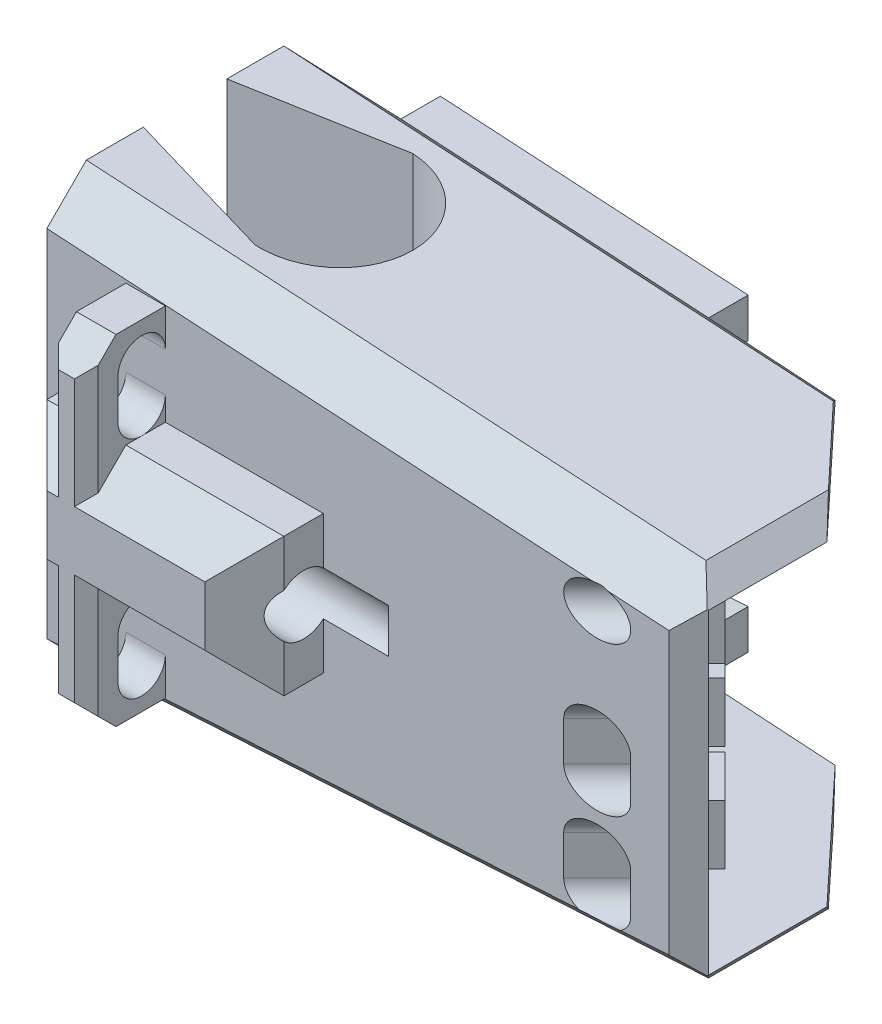
from build123d import *

# Parameters (mm, degrees)
BOSS_EXTRUDE1_DEPTH      = 7
CHAMFER1_SIZE            = 1
CHAMFER7_SIZE            = 1
CHAMFER7_EDGE_2_SIZE     = 1
CHAMFER7_EDGE_2_SIZE2    = 1.065385663
CHAMFER7_EDGE_3_SIZE     = 1
CHAMFER7_EDGE_4_SIZE     = 1
CHAMFER7_EDGE_4_SIZE2    = 1.065385663
CHAMFER14_SIZE           = 1
CHAMFER14_SIZE2          = 1.962610506
SKETCH13_W               = 6
SKETCH13_H               = 3.5
BOSS_EXTRUDE4_DEPTH      = 2
CUT_EXTRUDE9_DEPTH       = 2
CUT_EXTRUDE9_DEPTH_BACK  = 7.647280269
SKETCH14_R               = 0.75
CHAMFER15_SIZE           = 1
SKETCH15_W               = 4
SKETCH15_H               = 3.5
BOSS_EXTRUDE6_DEPTH      = 2
CUT_EXTRUDE10_DEPTH      = 2
CUT_EXTRUDE10_DEPTH_BACK = 6
SKETCH18_R               = 0.75
CHAMFER16_SIZE           = 1
CUT_EXTRUDE12_REACH      = 23.967
SKETCH19_W               = 7.661214419
SKETCH19_H               = 8
CUT_EXTRUDE14_DEPTH      = 10
CUT_EXTRUDE14_DEPTH_BACK = 2
SKETCH23_W               = 1.5
SKETCH23_H               = 1.5
BOSS_EXTRUDE7_DEPTH      = 0.3
SKETCH30_W               = 1
SKETCH30_H               = 3.55
BOSS_EXTRUDE12_DEPTH     = 2
CHAMFER19_SIZE           = 0.3
CHAMFER20_SIZE           = 0.75
CUT_EXTRUDE32_DEPTH      = 1.23
CUT_EXTRUDE33_REACH      = 23.588
CUT_EXTRUDE34_REACH      = 23.045
SKETCH38_R               = 0.6
BOSS_EXTRUDE13_DEPTH     = 1
CUT_EXTRUDE35_DEPTH      = 1


with BuildPart() as part:
    # Sketch2 → Boss-Extrude1 (new body)
    with BuildSketch(Plane.XY):
        Polygon((0, 0), (0, 11), (16.75, 10), (16.75, 1), align=None)
    extrude(amount=BOSS_EXTRUDE1_DEPTH)

    # Chamfer1
    chamfer1_edges = [part.edges().sort_by_distance(p)[0] for p in [
        (8.375, 10.5, 7),
        (8.375, 0.5, 7),
        (8.375, 10.5, 0),
        (8.375, 0.5, 0),
    ]]
    chamfer(chamfer1_edges, length=CHAMFER1_SIZE)

    # Chamfer7
    chamfer7_edges = [part.edges().sort_by_distance(p)[0] for p in [
        (16.75, 5.5, 7),
    ]]
    chamfer(chamfer7_edges, length=CHAMFER7_SIZE)

    # Chamfer7 edge 2
    chamfer7_edge_2_edges = [part.edges().sort_by_distance(p)[0] for p in [
        (16.75, 1, 3.5),
    ]]
    chamfer7_edge_2_side = [part.faces().sort_by_distance(p)[0] for p in [
        (8.375, 0.5, 3.5),
    ]]
    chamfer(chamfer7_edge_2_edges, length=CHAMFER7_EDGE_2_SIZE, length2=CHAMFER7_EDGE_2_SIZE2, reference=chamfer7_edge_2_side[0])

    # Chamfer7 edge 3
    chamfer7_edge_3_edges = [part.edges().sort_by_distance(p)[0] for p in [
        (16.75, 5.5, 0),
    ]]
    chamfer(chamfer7_edge_3_edges, length=CHAMFER7_EDGE_3_SIZE)

    # Chamfer7 edge 4
    chamfer7_edge_4_edges = [part.edges().sort_by_distance(p)[0] for p in [
        (16.75, 10, 3.5),
    ]]
    chamfer7_edge_4_side = [part.faces().sort_by_distance(p)[0] for p in [
        (16.75, 5.5, 3.5),
    ]]
    chamfer(chamfer7_edge_4_edges, length=CHAMFER7_EDGE_4_SIZE, length2=CHAMFER7_EDGE_4_SIZE2, reference=chamfer7_edge_4_side[0])

    # Chamfer14
    chamfer14_edges = [part.edges().sort_by_distance(p)[0] for p in [
        (0, 5.5, 0),
    ]]
    chamfer14_side = [part.faces().sort_by_distance(p)[0] for p in [
        (0, 5.5, 3.5),
    ]]
    chamfer(chamfer14_edges, length=CHAMFER14_SIZE, length2=CHAMFER14_SIZE2, reference=chamfer14_side[0])

    # Sketch13 → Boss-Extrude4 (add)
    with BuildSketch(Plane.XY.offset(7)):
        with Locations((4, 5.5)):
            Rectangle(SKETCH13_W, SKETCH13_H)
    extrude(amount=BOSS_EXTRUDE4_DEPTH)

    # Sketch14 → Cut-Extrude9 (cut, two sides: drawn at the far end of the back side and taken through both)
    with BuildSketch(Plane.ZY.offset(-1).offset(-CUT_EXTRUDE9_DEPTH_BACK)):
        with Locations(Location((7.5, 5.5, 0), (0, 0, 131.810314896))):
            Circle(SKETCH14_R)
    extrude(amount=CUT_EXTRUDE9_DEPTH + CUT_EXTRUDE9_DEPTH_BACK, mode=Mode.SUBTRACT)

    # Chamfer15
    # the kernel refuses this chamfer: 1 mm, written as the material it takes off along each edge
    with BuildSketch(Plane(origin=(7, 1.178317012, 9), x_dir=(0.027495876610586487, 0, -0.9996219169112968), z_dir=(0, 1, 0)), Plane(origin=(1, 9.821682988, 9), x_dir=(-0.02749587661058638, 0, -0.9996219169112968), z_dir=(0, -1, 0))) as chamfer15_piece_1:
        Polygon((CHAMFER15_SIZE * 0.999621916911, CHAMFER15_SIZE * 0.0274958766106), (-CHAMFER15_SIZE * 0.0274958766106, CHAMFER15_SIZE * 0.999621916911), (0, 0), align=None)
    extrude(amount=8.643365976, mode=Mode.SUBTRACT)
    with BuildSketch(Plane(origin=(9.571682988, 7.25, 9), x_dir=(0, 0.027495876610586487, -0.9996219169112968), z_dir=(-1, 0, 0)), Plane(origin=(-1.571682988, 3.75, 9), x_dir=(0, -0.027495876610586487, -0.9996219169112968), z_dir=(1, 0, 0))) as chamfer15_piece_2:
        Polygon((CHAMFER15_SIZE * 0.999621916911, CHAMFER15_SIZE * 0.0274958766106), (-CHAMFER15_SIZE * 0.0274958766106, CHAMFER15_SIZE * 0.999621916911), (0, 0), align=None)
    extrude(amount=11.143365976, mode=Mode.SUBTRACT)

    # Sketch15 → Boss-Extrude6 (add)
    with BuildSketch(Plane(origin=(0, 0, 0), x_dir=(-1, 0, 0), z_dir=(0, 0, -1))):
        with Locations((-4.962610506, 5.5)):
            Rectangle(SKETCH15_W, SKETCH15_H)
    extrude(amount=BOSS_EXTRUDE6_DEPTH)

    # Sketch18 → Cut-Extrude10 (cut, two sides: drawn at the far end of the back side and taken through both)
    with BuildSketch(Plane.ZY.offset(-2.962610506).offset(-CUT_EXTRUDE10_DEPTH_BACK)):
        with Locations(Location((-0.5, 5.5, 0), (0, 0, 48.189685104))):
            Circle(SKETCH18_R)
    extrude(amount=CUT_EXTRUDE10_DEPTH + CUT_EXTRUDE10_DEPTH_BACK, mode=Mode.SUBTRACT)

    # Chamfer16
    # the kernel refuses this chamfer: 1 mm, written as the material it takes off along each edge
    with BuildSketch(Plane(origin=(6.962610506, 1.178317012, -2), x_dir=(0.027495876610586487, 0, 0.9996219169112968), z_dir=(0, 1, 0)), Plane(origin=(2.962610506, 9.821682988, -2), x_dir=(-0.027495876610586487, 0, 0.9996219169112968), z_dir=(0, -1, 0))) as chamfer16_piece_1:
        Polygon((CHAMFER16_SIZE * 0.999621916911, -CHAMFER16_SIZE * 0.0274958766106), (-CHAMFER16_SIZE * 0.0274958766106, -CHAMFER16_SIZE * 0.999621916911), (0, 0), align=None)
    extrude(amount=8.643365976, mode=Mode.SUBTRACT)
    with BuildSketch(Plane(origin=(0.390927518, 3.75, -2), x_dir=(0, -0.027495876610586487, 0.9996219169112968), z_dir=(1, 0, 0)), Plane(origin=(9.534293493, 7.25, -2), x_dir=(0, 0.027495876610586487, 0.9996219169112968), z_dir=(-1, 0, 0))) as chamfer16_piece_2:
        Polygon((CHAMFER16_SIZE * 0.999621916911, -CHAMFER16_SIZE * 0.0274958766106), (-CHAMFER16_SIZE * 0.0274958766106, -CHAMFER16_SIZE * 0.999621916911), (0, 0), align=None)
    extrude(amount=9.143365976, mode=Mode.SUBTRACT)

    # Cut-Extrude12: up to this plane
    cut_extrude12_end = Plane(origin=(4.875, 0, -4.875), z_dir=(0.7071067811865475, 0, -0.7071067811865477))
    # Sketch19 → Cut-Extrude12 (cut, up to the surface)
    with BuildSketch(Plane(origin=(0, 0, 0), x_dir=(-1, 0, 0), z_dir=(0, 0, -1)), mode=Mode.PRIVATE) as cut_extrude12_sk1:
        with Locations((-13.585935075, 5.5)):
            Rectangle(SKETCH19_W, SKETCH19_H)
    cut_extrude12_tool1 = split(extrude(cut_extrude12_sk1.sketch, amount=-CUT_EXTRUDE12_REACH, mode=Mode.PRIVATE), bisect_by=cut_extrude12_end, keep=Keep.BOTH, mode=Mode.PRIVATE)
    add(cut_extrude12_tool1.solids().sort_by_distance((13.585935, 5.5, 0))[0], mode=Mode.SUBTRACT)

    # Sketch21 → Cut-Extrude14 (cut, two sides: drawn at the far end of the back side and taken through both)
    with BuildSketch(Plane.XZ.offset(-9.5).offset(-CUT_EXTRUDE14_DEPTH_BACK)):
        Polygon((16.25, 3.5), (16.25, 0.5), (16.25, -4.059078881), (11.307076373, -4.059078881), (13.25, 0.292304862), align=None)
    extrude(amount=CUT_EXTRUDE14_DEPTH + CUT_EXTRUDE14_DEPTH_BACK, mode=Mode.SUBTRACT)

    # Sketch23 → Boss-Extrude7 (add)
    with BuildSketch(Plane(origin=(4.875, 0, -4.875), x_dir=(-0.7071067811865476, 0, -0.7071067811865476), z_dir=(0.7071067811865476, 0, -0.7071067811865476))):
        Polygon((-10.402444277, 2.500721643), (-10.402135029, 4.000721611), (-8.902135061, 4.000412363), (-8.902444309, 2.500412395), align=None)
        with Locations((-9.651825855, 7.75)):
            Rectangle(SKETCH23_W, SKETCH23_H)
        Polygon((-12.702349723, 2.500380076), (-12.703104511, 4.000379886), (-14.203104321, 3.999625098), (-14.202349533, 2.499625288), align=None)
        Polygon((-14.204750024, 8.499212445), (-12.70475009, 8.499657985), (-12.70430455, 6.999658051), (-14.204304484, 6.999212511), align=None)
    extrude(amount=BOSS_EXTRUDE7_DEPTH)

    # Sketch30 → Boss-Extrude12 (add)
    with BuildSketch(Plane.XY.offset(7)):
        with Locations((2.5, 8.025)):
            Rectangle(SKETCH30_W, SKETCH30_H)
        with Locations((2.5, 2.975)):
            Rectangle(SKETCH30_W, SKETCH30_H)
    extrude(amount=BOSS_EXTRUDE12_DEPTH)

    # Chamfer19
    # the kernel refuses this chamfer: 0.3 mm, written as the material it takes off along each edge
    with BuildSketch(Plane(origin=(2, 6.25, 9), x_dir=(-0.027495876610586622, 0, -0.9996219169112968), z_dir=(0, 1, 0))) as chamfer19_piece_1_section:
        Polygon((CHAMFER19_SIZE * 0.999621916911, -CHAMFER19_SIZE * 0.0274958766106), (-CHAMFER19_SIZE * 0.0274958766106, -CHAMFER19_SIZE * 0.999621916911), (0, 0), align=None)
    chamfer19_piece_1 = extrude(amount=4.321504896, mode=Mode.PRIVATE)
    chamfer19_piece_1 = split(chamfer19_piece_1, bisect_by=Plane(origin=(2.100724638, 7.211413043, 8.038586957), z_dir=(0, 0.7071067811862649, 0.7071067811868302)), keep=Keep.TOP, mode=Mode.PRIVATE)
    add(chamfer19_piece_1, mode=Mode.SUBTRACT)
    with BuildSketch(Plane(origin=(3, 10.571504896, 9), x_dir=(0.027495876610585904, 0, -0.9996219169112968), z_dir=(0, -1, 0))) as chamfer19_piece_2_section:
        Polygon((CHAMFER19_SIZE * 0.999621916911, -CHAMFER19_SIZE * 0.0274958766106), (-CHAMFER19_SIZE * 0.0274958766106, -CHAMFER19_SIZE * 0.999621916911), (0, 0), align=None)
    chamfer19_piece_2 = extrude(amount=5.093009793, mode=Mode.PRIVATE)
    chamfer19_piece_2 = split(chamfer19_piece_2, bisect_by=Plane(origin=(2.899275362, 7.211413043, 8.038586957), z_dir=(0, 0.7071067811862649, 0.7071067811868302)), keep=Keep.TOP, mode=Mode.PRIVATE)
    add(chamfer19_piece_2, mode=Mode.SUBTRACT)
    with BuildSketch(Plane(origin=(2, 0.428495104, 9), x_dir=(-0.027495876610586622, 0, -0.9996219169112968), z_dir=(0, 1, 0))) as chamfer19_piece_3_section:
        Polygon((CHAMFER19_SIZE * 0.999621916911, -CHAMFER19_SIZE * 0.0274958766106), (-CHAMFER19_SIZE * 0.0274958766106, -CHAMFER19_SIZE * 0.999621916911), (0, 0), align=None)
    chamfer19_piece_3 = extrude(amount=4.321504896, mode=Mode.PRIVATE)
    chamfer19_piece_3 = split(chamfer19_piece_3, bisect_by=Plane(origin=(2.100724638, 3.788586957, 8.038586957), z_dir=(0, -0.7071067811862649, 0.7071067811868302)), keep=Keep.TOP, mode=Mode.PRIVATE)
    add(chamfer19_piece_3, mode=Mode.SUBTRACT)
    with BuildSketch(Plane(origin=(3, 5.521504896, 9), x_dir=(0.027495876610585904, 0, -0.9996219169112968), z_dir=(0, -1, 0))) as chamfer19_piece_4_section:
        Polygon((CHAMFER19_SIZE * 0.999621916911, -CHAMFER19_SIZE * 0.0274958766106), (-CHAMFER19_SIZE * 0.0274958766106, -CHAMFER19_SIZE * 0.999621916911), (0, 0), align=None)
    chamfer19_piece_4 = extrude(amount=5.093009793, mode=Mode.PRIVATE)
    chamfer19_piece_4 = split(chamfer19_piece_4, bisect_by=Plane(origin=(2.899275362, 3.788586957, 8.038586957), z_dir=(0, -0.7071067811862649, 0.7071067811868302)), keep=Keep.TOP, mode=Mode.PRIVATE)
    add(chamfer19_piece_4, mode=Mode.SUBTRACT)

    # Chamfer20
    chamfer20_edges = [part.edges().sort_by_distance(p)[0] for p in [
        (2.5, 1.2, 9),
        (2.5, 9.8, 9),
    ]]
    chamfer(chamfer20_edges, length=CHAMFER20_SIZE)

    # Sketch35 → Cut-Extrude32 (cut)
    with BuildSketch(Plane.ZY.offset(-2)):
        with BuildLine():
            Line((8.2, 8.85), (8.2, 7.85))
            ThreePointArc((8.2, 7.85), (7.6, 7.25), (7, 7.85))
            Line((7, 7.85), (7, 8.85))
            ThreePointArc((7, 8.85), (7.6, 9.45), (8.2, 8.85))
        make_face()
        with BuildLine():
            Line((8.2, 3.15), (8.2, 2.15))
            ThreePointArc((8.2, 2.15), (7.6, 1.55), (7, 2.15))
            Line((7, 2.15), (7, 3.15))
            ThreePointArc((7, 3.15), (7.6, 3.75), (8.2, 3.15))
        make_face()
    extrude(amount=-CUT_EXTRUDE32_DEPTH, mode=Mode.SUBTRACT)

    # Cut-Extrude33: up to this plane
    cut_extrude33_end = Plane(origin=(0, 11, 7), z_dir=(-0.059595380047235344, -0.9982226157912, 0))
    # Sketch36 → Cut-Extrude33 (cut, up to the surface)
    with BuildSketch(Plane(origin=(0, 0, 0), x_dir=(0, 0, -1), z_dir=(0, 1, 0)), mode=Mode.PRIVATE) as cut_extrude33_sk1:
        with BuildLine():
            Line((-1.735294118, -2.828823529), (-3, 2.23))
            Line((-3, 2.23), (-4, 2.23))
            Line((-4, 2.23), (-5.264705882, -2.828823529))
            ThreePointArc((-5.264705882, -2.828823529), (-3.5, -1.77), (-1.735294118, -2.828823529))
        make_face()
    cut_extrude33_tool1 = split(extrude(cut_extrude33_sk1.sketch, amount=CUT_EXTRUDE33_REACH, mode=Mode.PRIVATE), bisect_by=cut_extrude33_end, keep=Keep.BOTH, mode=Mode.PRIVATE)
    add(cut_extrude33_tool1.solids().sort_by_distance((0.278692, 0, 3.5))[0], mode=Mode.SUBTRACT)
    # Sketch36 → Cut-Extrude33 (cut, up to the surface)
    with BuildSketch(Plane(origin=(0, 0, 0), x_dir=(0, 0, -1), z_dir=(0, 1, 0)), mode=Mode.PRIVATE) as cut_extrude33_sk2:
        with BuildLine():
            Line((-1.5, -3.77), (-1.735294118, -2.828823529))
            ThreePointArc((-1.735294118, -2.828823529), (-3.5, -1.77), (-5.264705882, -2.828823529))
            Line((-5.264705882, -2.828823529), (-5.5, -3.77))
            ThreePointArc((-5.5, -3.77), (-3.5, -5.77), (-1.5, -3.77))
        make_face()
    cut_extrude33_tool2 = split(extrude(cut_extrude33_sk2.sketch, amount=CUT_EXTRUDE33_REACH, mode=Mode.PRIVATE), bisect_by=cut_extrude33_end, keep=Keep.BOTH, mode=Mode.PRIVATE)
    add(cut_extrude33_tool2.solids().sort_by_distance((3.772955, 0, 3.5))[0], mode=Mode.SUBTRACT)

    # Cut-Extrude34: up to this plane
    cut_extrude34_end = Plane(origin=(0, 0, 7), z_dir=(0, 0, -1))
    # Sketch38 → Cut-Extrude34 (cut, up to the surface)
    with BuildSketch(Plane(origin=(4.875, 0, -4.875), x_dir=(-0.7071067811865476, 0, -0.7071067811865476), z_dir=(0.7071067811865476, 0, -0.7071067811865476)), mode=Mode.PRIVATE) as cut_extrude34_sk1:
        with Locations((-14.802752351, 8.579711474)):
            Circle(SKETCH38_R)
    cut_extrude34_tool1 = split(extrude(cut_extrude34_sk1.sketch, amount=-CUT_EXTRUDE34_REACH, mode=Mode.PRIVATE), bisect_by=cut_extrude34_end, keep=Keep.BOTH, mode=Mode.PRIVATE)
    add(cut_extrude34_tool1.solids().sort_by_distance((15.342127, 8.579711, 5.592127))[0], mode=Mode.SUBTRACT)
    # Sketch38 → Cut-Extrude34 (cut, up to the surface)
    with BuildSketch(Plane(origin=(4.875, 0, -4.875), x_dir=(-0.7071067811865476, 0, -0.7071067811865476), z_dir=(0.7071067811865476, 0, -0.7071067811865476)), mode=Mode.PRIVATE) as cut_extrude34_sk2:
        with BuildLine():
            Line((-14.202752351, 5.8), (-14.202752351, 4.8))
            ThreePointArc((-14.202752351, 4.8), (-14.802752351, 4.2), (-15.402752351, 4.8))
            Line((-15.402752351, 4.8), (-15.402752351, 5.8))
            ThreePointArc((-15.402752351, 5.8), (-14.802752351, 6.4), (-14.202752351, 5.8))
        make_face()
    cut_extrude34_tool2 = split(extrude(cut_extrude34_sk2.sketch, amount=-CUT_EXTRUDE34_REACH, mode=Mode.PRIVATE), bisect_by=cut_extrude34_end, keep=Keep.BOTH, mode=Mode.PRIVATE)
    add(cut_extrude34_tool2.solids().sort_by_distance((15.342127, 5.3, 5.592127))[0], mode=Mode.SUBTRACT)
    # Sketch38 → Cut-Extrude34 (cut, up to the surface)
    with BuildSketch(Plane(origin=(4.875, 0, -4.875), x_dir=(-0.7071067811865476, 0, -0.7071067811865476), z_dir=(0.7071067811865476, 0, -0.7071067811865476)), mode=Mode.PRIVATE) as cut_extrude34_sk3:
        with BuildLine():
            Line((-14.202752351, 3.3), (-14.202752351, 2.3))
            ThreePointArc((-14.202752351, 2.3), (-14.802752351, 1.7), (-15.402752351, 2.3))
            Line((-15.402752351, 2.3), (-15.402752351, 3.3))
            ThreePointArc((-15.402752351, 3.3), (-14.802752351, 3.9), (-14.202752351, 3.3))
        make_face()
    cut_extrude34_tool3 = split(extrude(cut_extrude34_sk3.sketch, amount=-CUT_EXTRUDE34_REACH, mode=Mode.PRIVATE), bisect_by=cut_extrude34_end, keep=Keep.BOTH, mode=Mode.PRIVATE)
    add(cut_extrude34_tool3.solids().sort_by_distance((15.342127, 2.8, 5.592127))[0], mode=Mode.SUBTRACT)

    # Sketch39 → Boss-Extrude13 (add)
    with BuildSketch(Plane(origin=(0, 0, 0), x_dir=(-1, 0, 0), z_dir=(0, 0, -1))):
        Polygon((-2.962610506, 3.75), (-2.962610506, 2.180433367), (-1.962610506, 2.120731874), (-1.962610506, 4.345491503), (-2.962610506, 4.345491503), align=None)
        Polygon((-2.962610506, 2.180433367), (-9.755327865, 2.585968732), (-9.755327865, 1.584188183), (-1.962610506, 1.118951325), (-1.962610506, 2.120731874), align=None)
        Polygon((-1.962610506, 6.654508497), (-1.962610506, 8.879268126), (-2.962610506, 8.819566633), (-2.962610506, 7.25), (-2.962610506, 6.654508497), align=None)
        Polygon((-1.962610506, 8.879268126), (-1.962610506, 9.881048675), (-9.755327865, 9.415811817), (-9.755327865, 8.414031268), (-2.962610506, 8.819566633), align=None)
    extrude(amount=BOSS_EXTRUDE13_DEPTH)

    # Sketch41 → Cut-Extrude35 (cut)
    with BuildSketch(Plane(origin=(0, 0, 0), x_dir=(-1, 0, 0), z_dir=(0, 0, -1))):
        with BuildLine():
            Line((-8.969406145, 8.195669333), (-7.567261367, 8.195669333))
            ThreePointArc((-7.567261367, 8.195669333), (-7.067261367, 7.695669333), (-7.567261367, 7.195669333))
            Line((-7.567261367, 7.195669333), (-8.969406145, 7.195669333))
            ThreePointArc((-8.969406145, 7.195669333), (-9.469406145, 7.695669333), (-8.969406145, 8.195669333))
        make_face()
        with BuildLine():
            Line((-8.969406145, 3.767476747), (-7.567261367, 3.767476747))
            ThreePointArc((-7.567261367, 3.767476747), (-7.067261367, 3.267476747), (-7.567261367, 2.767476747))
            Line((-7.567261367, 2.767476747), (-8.969406145, 2.767476747))
            ThreePointArc((-8.969406145, 2.767476747), (-9.469406145, 3.267476747), (-8.969406145, 3.767476747))
        make_face()
    extrude(amount=-CUT_EXTRUDE35_DEPTH, mode=Mode.SUBTRACT)


solid = part.part
